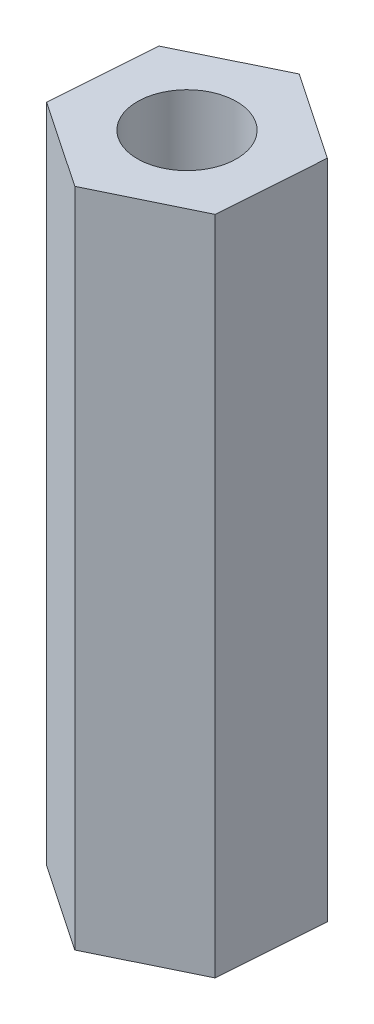
from build123d import *

# Parameters (mm, degrees)
SKETCH1_R           = 1.5
BOSS_EXTRUDE1_DEPTH = 20


with BuildPart() as part:
    # Sketch1 → Boss-Extrude1 (new body)
    with BuildSketch(Plane(origin=(0, 0, 0), x_dir=(1, 0, 0), z_dir=(0, 1, 0))):
        Polygon((2.630154555, -1.779219028), (2.855926154, 1.388171147), (0.225771599, 3.167390175), (-2.630154555, 1.779219028), (-2.855926154, -1.388171147), (-0.225771599, -3.167390175), align=None)
        Circle(SKETCH1_R, mode=Mode.SUBTRACT)
    extrude(amount=BOSS_EXTRUDE1_DEPTH)


solid = part.part
